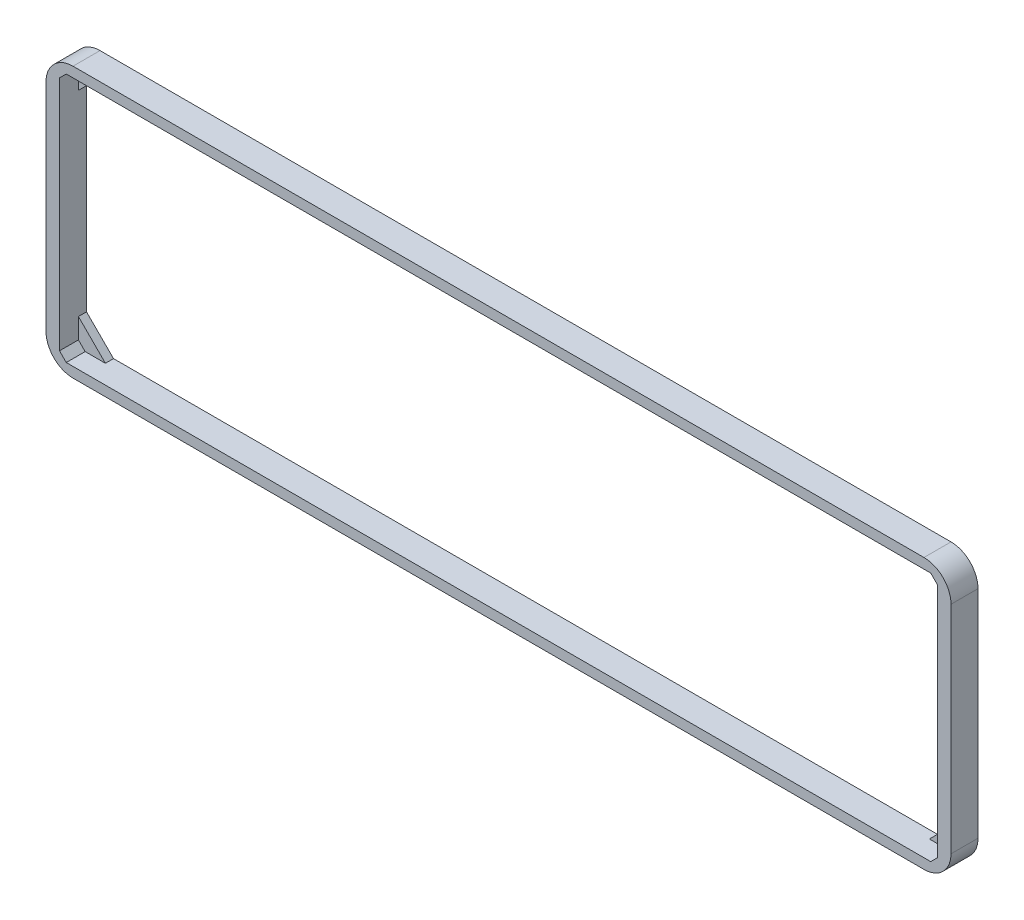
from build123d import *

# Parameters (mm, degrees)
SKETCH1_W           = 335
SKETCH1_H           = 100
SKETCH1_W_2         = 325
SKETCH1_H_2         = 92.5
BOSS_EXTRUDE1_DEPTH = 10
FILLET1_R           = 10
BOSS_EXTRUDE2_DEPTH = 3
CHAMFER1_SIZE       = 2.5


with BuildPart() as part:
    # Sketch1 → Boss-Extrude1 (new body)
    with BuildSketch(Plane.XY):
        Rectangle(SKETCH1_W, SKETCH1_H)
        Rectangle(SKETCH1_W_2, SKETCH1_H_2, mode=Mode.SUBTRACT)
    extrude(amount=-BOSS_EXTRUDE1_DEPTH)

    # Fillet1
    fillet1_edges = [part.edges().sort_by_distance(p)[0] for p in [
        (-167.5, 50, -5),
        (-167.5, -50, -5),
        (167.5, -50, -5),
        (167.5, 50, -5),
    ]]
    fillet(fillet1_edges, radius=FILLET1_R)

    # Sketch2 → Boss-Extrude2 (add)
    with BuildSketch(Plane(origin=(0, 0, -10), x_dir=(-1, 0, 0), z_dir=(0, 0, -1))):
        Polygon((-162.5, -46.25), (-162.5, -36.25), (-152.5, -46.25), align=None)
        Polygon((-162.5, 46.25), (-152.5, 46.25), (-162.5, 36.25), align=None)
        Polygon((162.5, 46.25), (152.5, 46.25), (162.5, 36.25), align=None)
        Polygon((162.5, -46.25), (162.5, -36.25), (152.5, -46.25), align=None)
    extrude(amount=-BOSS_EXTRUDE2_DEPTH)

    # Chamfer1
    chamfer1_edges = [part.edges().sort_by_distance(p)[0] for p in [
        (162.5, -46.25, -3.5),
        (162.5, 46.25, -3.5),
        (-162.5, -46.25, -3.5),
        (-162.5, 46.25, -3.5),
    ]]
    chamfer(chamfer1_edges, length=CHAMFER1_SIZE)


solid = part.part
